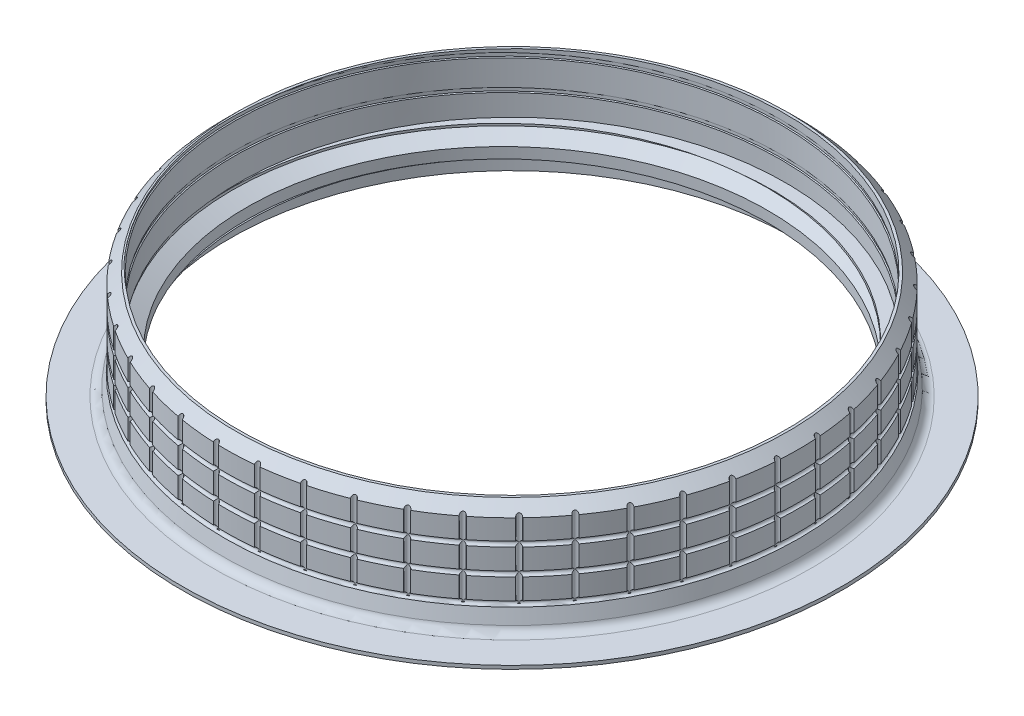
from build123d import *

# Parameters (mm, degrees)
UPPER_FA_ET_SIZE    = 1.2
SKETCH_4_R          = 0.3000000000000035
SKETCH_4_R_2        = 0.30000000000000365
SKETCH_4_R_3        = 0.3000000000000034
SKETCH_5_R          = 0.30000000000000354
SKETCH_5_R_2        = 0.30000000000000365
SKETCH_5_R_3        = 0.3000000000000034
SKETCH_5_R_4        = 0.3000000000000001
SKETCH_5_R_5        = 0.30000000000000054
SKETCH_5_R_6        = 0.3000000000000014
SKETCH_5_R_7        = 0.30000000000000077
SKETCH_5_R_8        = 0.3000000000000035
CUT_EXTRUDE_1_DEPTH = 10
THREAD_1_PITCH      = 3.5


with BuildPart() as part:
    # Sketch 1 → Повернуть1 (revolve)
    with BuildSketch(Plane.XY, mode=Mode.PRIVATE) as revolve_1_sk:
        with BuildLine():
            Line((-38.24999999999999, 0), (-32.65, 0))
            Line((-32.65, 0), (-32.65, 1.8))
            Line((-32.65, 1.8), (-30.25, 1.8))
            Line((-30.25, 1.8), (-30.25, 6))
            Line((-30.25, 6), (-31.75, 6))
            Line((-31.75, 6), (-31.75, 12.900000000000006))
            Line((-31.75, 12.900000000000006), (-33.25, 12.900000000000006))
            Line((-33.25, 12.900000000000006), (-33.25, 3))
            Line((-33.25, 3), (-33.6711214246228, 1.1751404933012444))
            ThreePointArc((-33.6711214246228, 1.1751404933012444), (-34.0229612195073, 0.6174210881007727), (-34.645512620317405, 0.40000000000000063))
            Line((-34.645512620317405, 0.40000000000000063), (-38.24999999999999, 0.4))
            Line((-38.24999999999999, 0.4), (-38.24999999999999, 0))
        make_face()
    revolve(revolve_1_sk.sketch.rotate(Axis((0, 0, 0), (0, 1, 0)), 270), axis=Axis((0, 0, 0), (0, 1, 0)))

    # Upper faсet
    upper_fa_et_edges = [part.edges().sort_by_distance(p)[0] for p in [
        (-1.145e-14, 12.900000000000006, 33.25),
    ]]
    chamfer(upper_fa_et_edges, length=UPPER_FA_ET_SIZE)

    # Эскиз4 → Grip (revolve, cut)
    with BuildSketch(Plane.XY, mode=Mode.PRIVATE) as grip_sk:
        with Locations((-33.25, 3.05382142887467)):
            Circle(SKETCH_4_R)
        with Locations((-33.25000000000001, 6.05382142887467)):
            Circle(SKETCH_4_R_2)
        with Locations((-33.25000000000002, 9.05382142887467)):
            Circle(SKETCH_4_R_3)
    revolve(grip_sk.sketch.rotate(Axis((0, 0, 0), (0, 1, 0)), 270), axis=Axis((0, 0, 0), (0, 1, 0)), mode=Mode.SUBTRACT)

    # Эскиз5 → Вырез-Вытянуть1 (cut)
    with BuildSketch(Plane(origin=(0, 12.900000000000006, 0), x_dir=(1, 0, 0), z_dir=(0, 1, 0))):
        with Locations((-33.25, 0)):
            Circle(SKETCH_5_R)
        with Locations((-32.92641328565722, 4.627505606922155)):
            Circle(SKETCH_5_R_2)
        with Locations((-31.961951389949103, 9.164942080915221)):
            Circle(SKETCH_5_R_3)
        with Locations((-30.375386466616487, 13.523993382270358)):
            Circle(SKETCH_5_R_4)
        with Locations((-28.19759919720116, 17.619815535754064)):
            Circle(SKETCH_5_R_5)
        with Locations((-25.470977733706025, 21.372688022077433)):
            Circle(SKETCH_5_R_5)
        with Locations((-22.24859266143204, 24.70956544712336)):
            Circle(SKETCH_5_R_5)
        with Locations((-18.593164040402332, 27.565499287455136)):
            Circle(SKETCH_5_R_5)
        with Locations((-14.575840630736828, 29.884902039447304)):
            Circle(SKETCH_5_R_5)
        with Locations((-10.274815062967004, 31.622629166813862)):
            Circle(SKETCH_5_R_5)
        with Locations((-5.773801907425437, 32.744857787655924)):
            Circle(SKETCH_5_R_6)
        with Locations((-1.1604082653581609, 33.22974499838494)):
            Circle(SKETCH_5_R_7)
        with Locations((3.4755714036494814, 33.06785302099509)):
            Circle(SKETCH_5_R_6)
        with Locations((8.043903028688954, 32.26233289867689)):
            Circle(SKETCH_5_R_5)
        with Locations((12.455669231079076, 30.828863164345684)):
            Circle(SKETCH_5_R_5)
        with Locations((16.624999999999993, 28.79534467583259)):
            Circle(SKETCH_5_R_5)
        with Locations((20.47074405457814, 26.201357557423513)):
            Circle(SKETCH_5_R_5)
        with Locations((23.91804836126016, 23.097390817761656)):
            Circle(SKETCH_5_R_5)
        with Locations((26.899815062967, 19.543859638724737)):
            Circle(SKETCH_5_R_5)
        with Locations((29.35800746255932, 15.609929462630866)):
            Circle(SKETCH_5_R_5)
        with Locations((31.24477964113146, 11.372169765578493)):
            Circle(SKETCH_5_R_4)
        with Locations((32.52340772439904, 6.913063719690497)):
            Circle(SKETCH_5_R_2)
        with Locations((33.16900467113916, 2.319402751992174)):
            Circle(SKETCH_5_R_8)
        with Locations((33.16900467113916, -2.319402751992166)):
            Circle(SKETCH_5_R_8)
        with Locations((32.523407724399036, -6.913063719690504)):
            Circle(SKETCH_5_R_2)
        with Locations((31.24477964113146, -11.372169765578484)):
            Circle(SKETCH_5_R_4)
        with Locations((29.358007462559318, -15.609929462630873)):
            Circle(SKETCH_5_R_4)
        with Locations((26.899815062967008, -19.543859638724733)):
            Circle(SKETCH_5_R_5)
        with Locations((23.918048361260155, -23.097390817761667)):
            Circle(SKETCH_5_R_5)
        with Locations((20.470744054578134, -26.201357557423513)):
            Circle(SKETCH_5_R_5)
        with Locations((16.625000000000014, -28.795344675832578)):
            Circle(SKETCH_5_R_5)
        with Locations((12.455669231079085, -30.82886316434568)):
            Circle(SKETCH_5_R_5)
        with Locations((8.043903028688954, -32.26233289867689)):
            Circle(SKETCH_5_R_5)
        with Locations((3.4755714036494743, -33.06785302099509)):
            Circle(SKETCH_5_R_6)
        with Locations((-1.1604082653581678, -33.22974499838494)):
            Circle(SKETCH_5_R_7)
        with Locations((-5.773801907425422, -32.744857787655924)):
            Circle(SKETCH_5_R_6)
        with Locations((-10.274815062966995, -31.622629166813862)):
            Circle(SKETCH_5_R_5)
        with Locations((-14.575840630736824, -29.884902039447304)):
            Circle(SKETCH_5_R_5)
        with Locations((-18.59316404040234, -27.565499287455133)):
            Circle(SKETCH_5_R_5)
        with Locations((-22.248592661432024, -24.709565447123374)):
            Circle(SKETCH_5_R_5)
        with Locations((-25.47097773370601, -21.372688022077444)):
            Circle(SKETCH_5_R_5)
        with Locations((-28.19759919720116, -17.61981553575407)):
            Circle(SKETCH_5_R_5)
        with Locations((-30.375386466616487, -13.523993382270357)):
            Circle(SKETCH_5_R_4)
        with Locations((-31.96195138994911, -9.164942080915218)):
            Circle(SKETCH_5_R_3)
        with Locations((-32.92641328565721, -4.627505606922191)):
            Circle(SKETCH_5_R_2)
    extrude(amount=-CUT_EXTRUDE_1_DEPTH, mode=Mode.SUBTRACT)

    # Резьба1: the profile of Sketch 1 2 profile screwed along a right-hand helix of 5.714286 turns, 12 arcs to a turn; built about Z, then put on its axis
    thread_1_z = Axis((0, 0, 0), (0, 0, 1))
    thread_1_corners = [(30.2497, 0, -0.000173205), (31.873797625, 0, 0.937499996), (31.873797625, 0, 1.312499996), (30.2497, 0, 2.250173197)]
    with BuildLine(mode=Mode.PRIVATE) as thread_1_profile:
        Line(thread_1_corners[0], thread_1_corners[1])
        Line(thread_1_corners[1], thread_1_corners[2])
        Line(thread_1_corners[2], thread_1_corners[3])
        Line(thread_1_corners[3], thread_1_corners[0])
    thread_1_cap = Face(thread_1_profile.wire())
    thread_1_turn_angles = [0, 15, 30, 45, 60, 75, 90, 105, 120, 135, 150, 165, 180, 195, 210, 225, 240, 255, 270, 285, 300, 315, 330, 345, 360]
    thread_1_turn_weights = [1, 0.9659258262890683, 1, 0.9659258262890683, 1, 0.9659258262890683, 1, 0.9659258262890683, 1, 0.9659258262890683, 1, 0.9659258262890683, 1, 0.9659258262890683, 1, 0.9659258262890683, 1, 0.9659258262890683, 1, 0.9659258262890683, 1, 0.9659258262890683, 1, 0.9659258262890683, 1]
    thread_1_turn_rails = [Edge.make_bspline([Vector(p[0], p[1], 0).rotate(thread_1_z, thread_1_turn_angles[k]) / thread_1_turn_weights[k] + Vector(0, 0, p[2] + THREAD_1_PITCH * thread_1_turn_angles[k] / 360) for k in range(25)], [0, 0, 0, 1, 1, 2, 2, 3, 3, 4, 4, 5, 5, 6, 6, 7, 7, 8, 8, 9, 9, 10, 10, 11, 11, 12, 12, 12], 2, thread_1_turn_weights) for p in thread_1_corners]
    thread_1_turn_sides = [Face.make_surface_from_curves(thread_1_turn_rails[p[0]], thread_1_turn_rails[p[1]]) for p in [(0, 1), (1, 2), (2, 3), (3, 0)]]
    thread_1_last_angles = [1800, 1815, 1830, 1845, 1860, 1875, 1890, 1905, 1920, 1935, 1950, 1965, 1980, 1995, 2010, 2025, 2040, 2048.571428571, 2057.142857143]
    thread_1_last_weights = [1, 0.9659258262890683, 1, 0.9659258262890683, 1, 0.9659258262890683, 1, 0.9659258262890683, 1, 0.9659258262890683, 1, 0.9659258262890683, 1, 0.9659258262890683, 1, 0.9659258262890683, 1, 0.9888308262251283, 1]
    thread_1_last_rails = [Edge.make_bspline([Vector(p[0], p[1], 0).rotate(thread_1_z, thread_1_last_angles[k]) / thread_1_last_weights[k] + Vector(0, 0, p[2] + THREAD_1_PITCH * thread_1_last_angles[k] / 360) for k in range(19)], [0, 0, 0, 1, 1, 2, 2, 3, 3, 4, 4, 5, 5, 6, 6, 7, 7, 8, 8, 9, 9, 9], 2, thread_1_last_weights) for p in thread_1_corners]
    thread_1_last_sides = [Face.make_surface_from_curves(thread_1_last_rails[p[0]], thread_1_last_rails[p[1]]) for p in [(0, 1), (1, 2), (2, 3), (3, 0)]]
    thread_1 = Plane(origin=(0, -4.2, 0), x_dir=(1, 0, 0), z_dir=(0, 1, 0)) * Solid(Shell([*[p.moved(Location((0, 0, THREAD_1_PITCH * i))) for i in range(5) for p in thread_1_turn_sides], *thread_1_last_sides, thread_1_cap, thread_1_cap.rotate(thread_1_z, 2057.142857143).moved(Location((0, 0, THREAD_1_PITCH * 2057.142857143 / 360)))]))
    add(thread_1, mode=Mode.SUBTRACT)


solid = part.part
